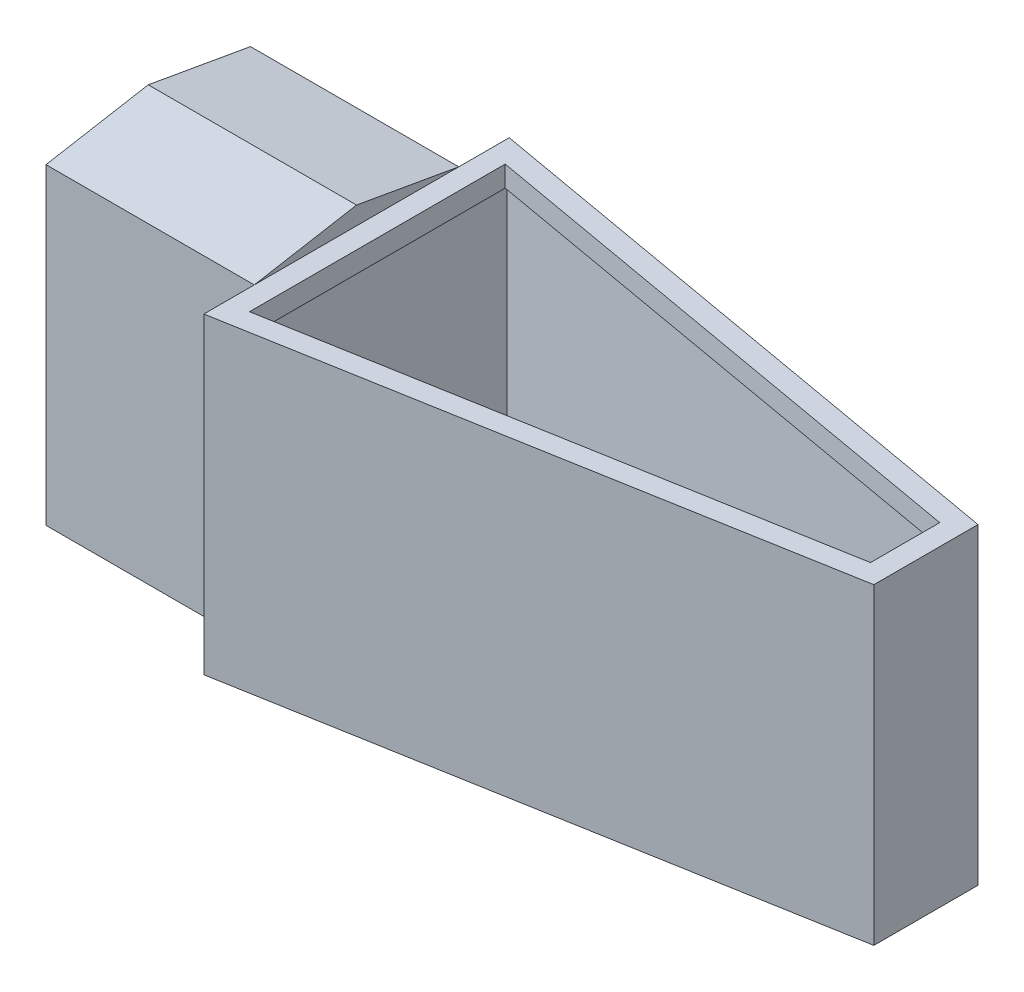
from build123d import *

# Parameters (mm, degrees)
BOSS_EXTRUDE1_DEPTH = 38.1
CUT_EXTRUDE1_DEPTH  = 2.54
CUT_EXTRUDE2_DEPTH  = 34.29
BOSS_EXTRUDE2_DEPTH = 25.4
SHELL1_START        = -12.546191045
SHELL1_DEPTH        = 24.13
SHELL1_2_DEPTH      = 22.86


# Read off the part's stored shape, not the designer's step: Shell1
with BuildPart() as part:
    # Sketch1 → Boss-Extrude1 (new body)
    with BuildSketch(Plane(origin=(0, 0, 0), x_dir=(1, 0, 0), z_dir=(0, 1, 0))):
        Polygon((12.853808955, 0.174987325), (12.853808955, 37.417012675), (82.296, 25.146), (82.296, 12.446), align=None)
    extrude(amount=BOSS_EXTRUDE1_DEPTH)

    # Sketch3 → Cut-Extrude1 (cut)
    with BuildSketch(Plane(origin=(0, 35.56, 0), x_dir=(1, 0, 0), z_dir=(0, 1, 0))):
        Polygon((79.756, 14.576512841), (79.756, 23.015487159), (15.393808955, 34.388821586), (15.393808955, 3.203178414), align=None)
    extrude(amount=CUT_EXTRUDE1_DEPTH, mode=Mode.SUBTRACT)

    # Sketch6 → Cut-Extrude2 (cut)
    with BuildSketch(Plane(origin=(0, 35.56, 0), x_dir=(1, 0, 0), z_dir=(0, 1, 0))):
        Polygon((81.026, 13.511256421), (81.026, 24.080743579), (14.123808955, 35.90291713), (14.123808955, 1.68908287), align=None)
    extrude(amount=-CUT_EXTRUDE2_DEPTH, mode=Mode.SUBTRACT)

    # Sketch8 → Boss-Extrude2 (add)
    with BuildSketch(Plane.ZY.offset(-12.853808955)):
        Polygon((-31.26502256, 38.1), (-31.26502256, 0), (-18.796, 2.1986251), (-6.32697744, 0), (-6.32697744, 38.1), (-18.796, 40.2986251), align=None)
    extrude(amount=BOSS_EXTRUDE2_DEPTH)

    # Shell1 outline → Shell1 (cut)
    with BuildSketch(Plane.YZ.offset(SHELL1_START)):
        Polygon((35.56, -28.72502256), (35.56, -8.86697744), (3.027054125, -8.86697744), (4.777808695, -18.796), (3.027054125, -28.72502256), align=None)
    extrude(amount=SHELL1_DEPTH, mode=Mode.SUBTRACT)

    # Shell1 2 outline → Shell1 2 (cut)
    with BuildSketch(Plane.YZ.offset(SHELL1_START)):
        Polygon((35.968686937, -8.86697744), (35.56, -8.86697744), (35.56, -28.72502256), (35.968686937, -28.72502256), (37.719441506, -18.796), align=None)
    extrude(amount=SHELL1_2_DEPTH, mode=Mode.SUBTRACT)


solid = part.part
